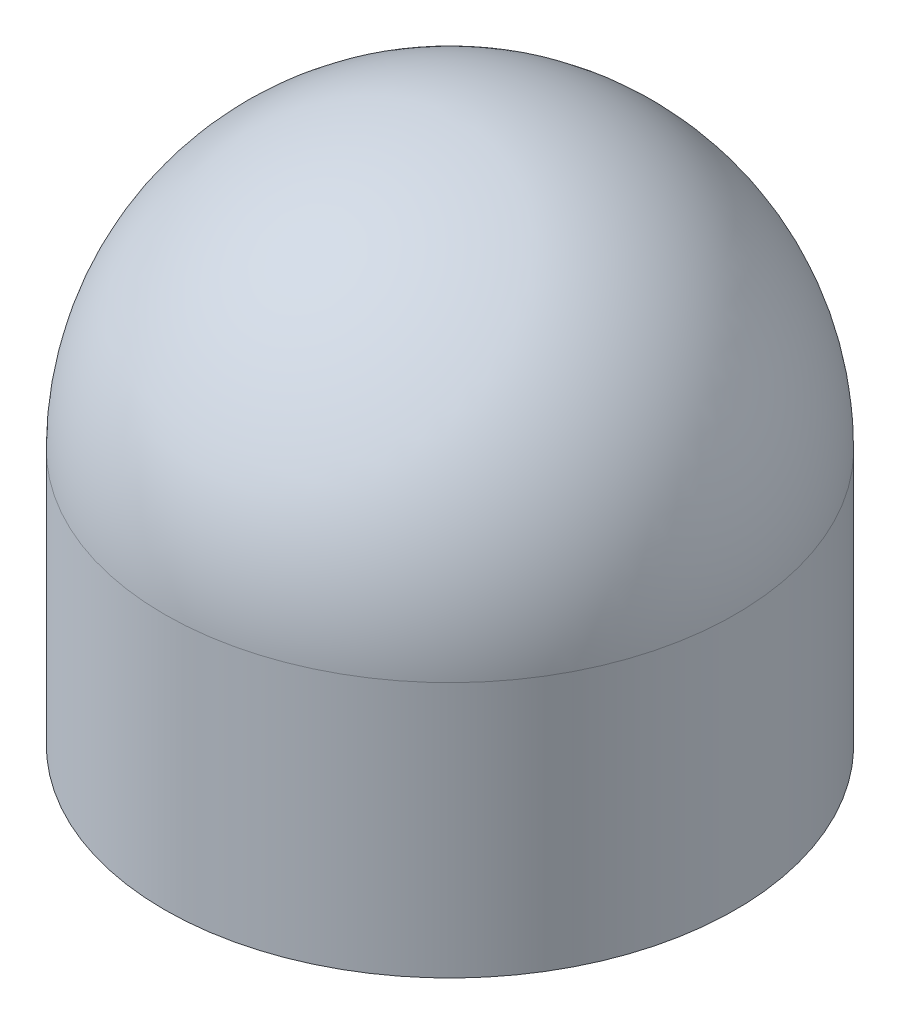
from build123d import *

# Parameters (mm, degrees)
SKETCH1_R           = 5
BOSS_EXTRUDE1_DEPTH = 9.48
FILLET1_R           = 5
SKETCH2_R           = 1.75
CUT_EXTRUDE1_DEPTH  = 4


with BuildPart() as part:
    # Sketch1 → Boss-Extrude1 (new body)
    with BuildSketch(Plane(origin=(0, 0, 0), x_dir=(1, 0, 0), z_dir=(0, 1, 0))):
        Circle(SKETCH1_R)
    extrude(amount=BOSS_EXTRUDE1_DEPTH)

    # Fillet1
    fillet1_edges = [part.edges().sort_by_distance(p)[0] for p in [
        (-5, 9.48, 0),
    ]]
    fillet(fillet1_edges, radius=FILLET1_R)

    # Sketch2 → Cut-Extrude1 (cut)
    with BuildSketch(Plane.XZ):
        Circle(SKETCH2_R)
    extrude(amount=-CUT_EXTRUDE1_DEPTH, mode=Mode.SUBTRACT)


solid = part.part
